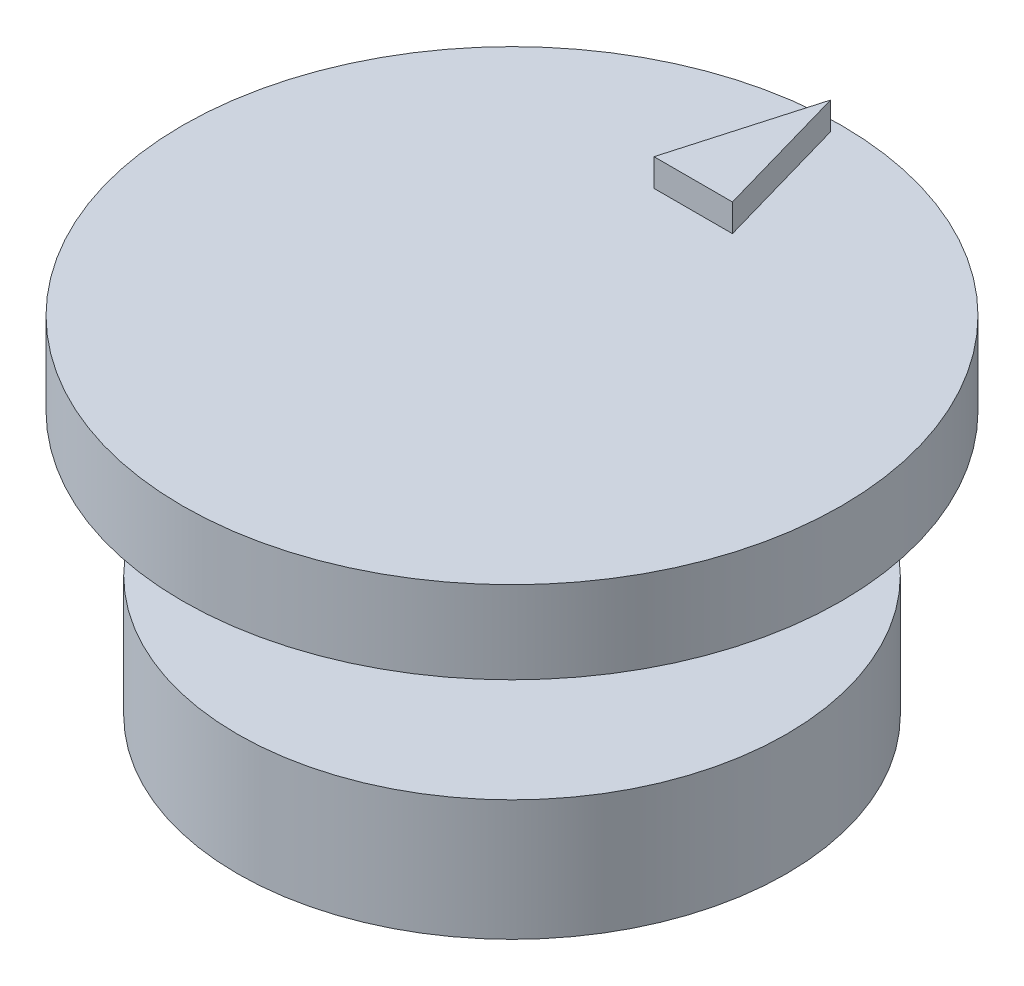
from build123d import *

# Parameters (mm, degrees)
ARROW_DEPTH = 1.27
SKETCH3_R   = 1.798915991
FLAG_DEPTH  = 6.35


with BuildPart() as part:
    # Sketch1 → dial base shape (revolve)
    with BuildSketch(Plane.XY):
        Polygon((0, -20.891058424), (0, -36.893058424), (12.7, -36.893058424), (12.7, -31.305058424), (3.175, -31.305058424), (3.175, -26.225058424), (12.7, -26.225058424), (12.7, -24.701058424), (15.24, -24.701058424), (15.24, -20.891058424), align=None)
    revolve(axis=Axis((0, -20.891058424, 0), (0, -1, 0)))

    # Sketch2 → arrow (add)
    with BuildSketch(Plane(origin=(0, -20.891058424, 0), x_dir=(1, 0, 0), z_dir=(0, 1, 0))):
        Polygon((0, 14.732), (-1.813922821, 8.382), (1.813922821, 8.382), align=None)
    extrude(amount=ARROW_DEPTH)

    # Sketch3 → flag (add)
    with BuildSketch(Plane.XZ.offset(36.893058424)):
        with Locations((0, -9.854910999)):
            Circle(SKETCH3_R)
    extrude(amount=FLAG_DEPTH)


solid = part.part
